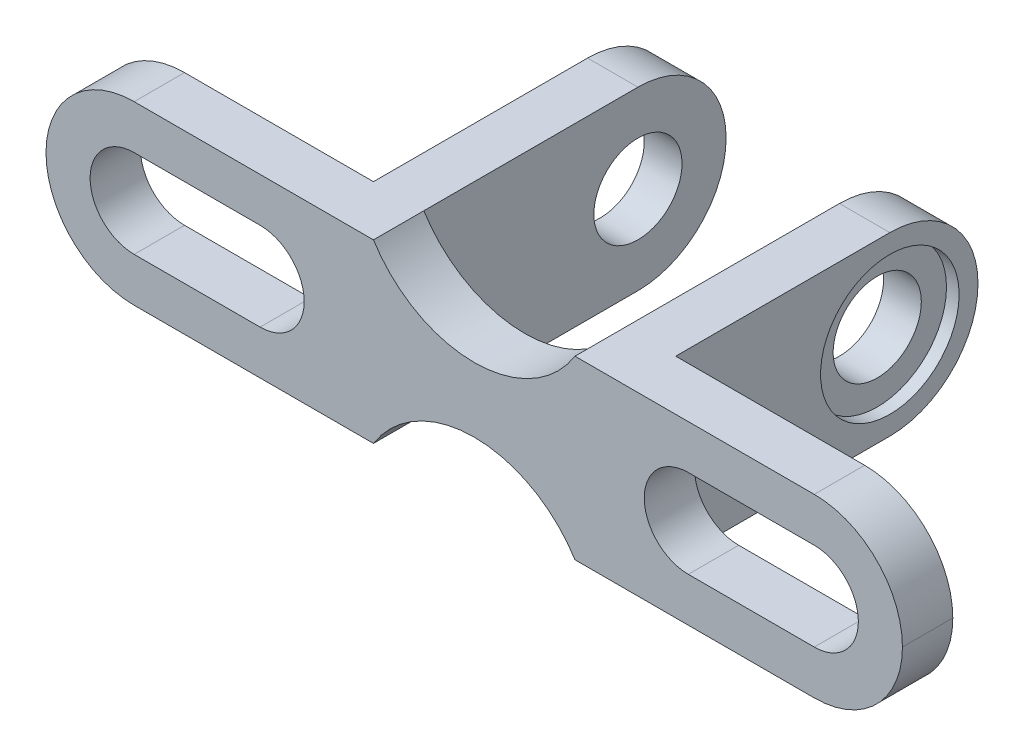
from build123d import *

# Parameters (mm, degrees)
EXTRUDE_2_DEPTH     = 2
SKETCH_4_W          = 2
SKETCH_4_H          = 7
EXTRUDE_3_DEPTH     = 12
FILLET_1_R          = 3.5
SKETCH_5_R          = 1.75
CUT_EXTRUDE_1_DEPTH = 27.177280225
FILLET_2_R          = 3.5
SKETCH_6_R          = 2.75
CUT_EXTRUDE_2_DEPTH = 0.5
CUT_EXTRUDE_START   = -0.5
SKETCH_7_R          = 2.75
CUT_EXTRUDE_3_DEPTH = 0.5


with BuildPart() as part:
    # 草图3 → 凸台-拉伸2 (new body)
    with BuildSketch(Plane.XY):
        with BuildLine():
            Line((-17, -3.5), (-4, -3.5))
            ThreePointArc((-4, -3.5), (0, -1.283009434), (4, -3.5))
            Line((4, -3.5), (17, -3.5))
            Line((17, -3.5), (17, 3.5))
            Line((17, 3.5), (4, 3.5))
            ThreePointArc((4, 3.5), (0, 1.283009434), (-4, 3.5))
            Line((-4, 3.5), (-17, 3.5))
            Line((-17, 3.5), (-17, -3.5))
        make_face()
        with BuildLine():
            Line((-13.5, 1.75), (-8.5, 1.75))
            ThreePointArc((-8.5, 1.75), (-6.75, 0), (-8.5, -1.75))
            Line((-8.5, -1.75), (-13.5, -1.75))
            ThreePointArc((-13.5, -1.75), (-15.25, 0), (-13.5, 1.75))
        make_face(mode=Mode.SUBTRACT)
        with BuildLine():
            Line((13.5, 1.75), (8.5, 1.75))
            ThreePointArc((8.5, 1.75), (6.75, 0), (8.5, -1.75))
            Line((8.5, -1.75), (13.5, -1.75))
            ThreePointArc((13.5, -1.75), (15.25, 0), (13.5, 1.75))
        make_face(mode=Mode.SUBTRACT)
    extrude(amount=EXTRUDE_2_DEPTH)

    # 草图4 → 凸台-拉伸3 (add)
    with BuildSketch(Plane(origin=(0, 0, 0), x_dir=(-1, 0, 0), z_dir=(0, 0, -1))):
        with Locations((-5, 0)):
            Rectangle(SKETCH_4_W, SKETCH_4_H)
        with Locations((5, 0)):
            Rectangle(SKETCH_4_W, SKETCH_4_H)
    extrude(amount=EXTRUDE_3_DEPTH)

    # 圆角1
    fillet_1_edges = [part.edges().sort_by_distance(p)[0] for p in [
        (-5, -3.5, -12),
        (-5, 3.5, -12),
        (5, -3.5, -12),
        (5, 3.5, -12),
    ]]
    fillet(fillet_1_edges, radius=FILLET_1_R - 0.0001)  # a hair under: the kernel refuses the full size

    # 草图5 → 切除-拉伸1 (cut, through all)
    with BuildSketch(Plane(origin=(6, 0, 0), x_dir=(0, 0, -1), z_dir=(1, 0, 0))):
        with Locations(Location((8.5, 0, 0), (0, 0, 270))):
            Circle(SKETCH_5_R)
    extrude(amount=-CUT_EXTRUDE_1_DEPTH, mode=Mode.SUBTRACT)

    # 圆角2
    fillet_2_edges = [part.edges().sort_by_distance(p)[0] for p in [
        (17, -3.5, 1),
        (17, 3.5, 1),
        (-17, -3.5, 1),
        (-17, 3.5, 1),
    ]]
    fillet(fillet_2_edges, radius=FILLET_2_R - 0.0001)  # a hair under: the kernel refuses the full size

    # 草图6 → 切除-拉伸2 (cut)
    with BuildSketch(Plane(origin=(6, 0, 0), x_dir=(0, 0, -1), z_dir=(1, 0, 0))):
        with Locations((8.5, 0)):
            Circle(SKETCH_6_R)
    extrude(amount=-CUT_EXTRUDE_2_DEPTH, mode=Mode.SUBTRACT)

    # 草图7 → 切除-拉伸3 (cut)
    with BuildSketch(Plane.ZY.offset(6).offset(CUT_EXTRUDE_START)):
        with Locations(Location((-8.5, 0, 0), (0, 0, 180))):
            Circle(SKETCH_7_R)
    extrude(amount=CUT_EXTRUDE_3_DEPTH, mode=Mode.SUBTRACT)


solid = part.part
